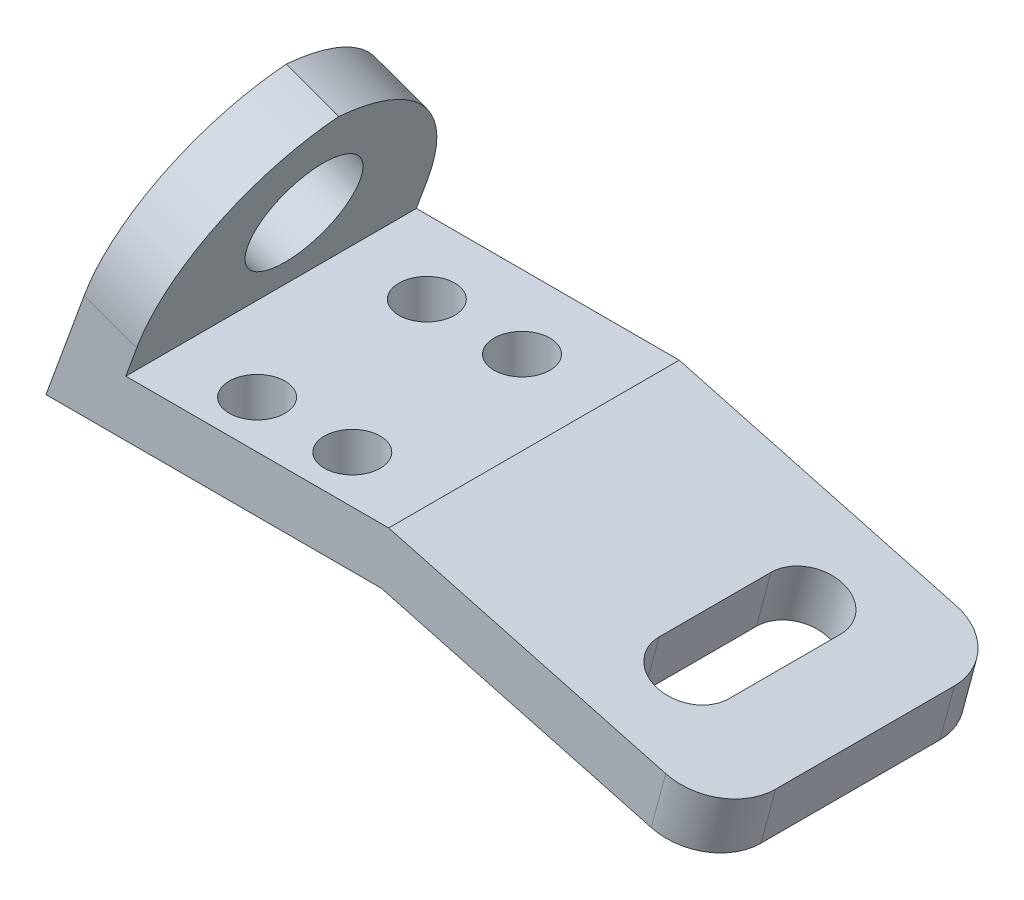
from build123d import *

# Parameters (mm, degrees)
EXTRUDE_THIN1_DEPTH = 52
SKETCH2_R           = 10
CUT_EXTRUDE2_DEPTH  = 10
FILLET1_R           = 30
CUT_EXTRUDE3_DEPTH  = 10
FILLET2_R           = 10
SKETCH4_R           = 5
CUT_EXTRUDE4_DEPTH  = 10


with BuildPart() as part:
    # Sketch1 → Extrude-Thin1 (new body)
    with BuildSketch(Plane.XY):
        Polygon((17.101007166, 46.984631039), (0, 0), (60, 0), (117.955549577, -15.529142706), (120.543740028, -5.869884443), (61.316524976, 10), (14.281480067, 10), (26.497933374, 43.564429606), align=None)
    extrude(amount=EXTRUDE_THIN1_DEPTH)

    # Sketch2 → Cut-Extrude2 (cut)
    with BuildSketch(Plane(origin=(0, 0, 0), x_dir=(0, 0, 1), z_dir=(-0.9396926207859096, 0.34202014332566566, 0))):
        with Locations(Location((25.484668599, 30, 0), (0, 0, 270))):
            Circle(SKETCH2_R)
    extrude(amount=-CUT_EXTRUDE2_DEPTH, mode=Mode.SUBTRACT)

    # Fillet1
    # the kernel refuses this fillet: 30 mm, written as the material it takes off along each edge
    with BuildSketch(Plane(origin=(96.974879933, 17.912918857, 0), x_dir=(0, 0, 1), z_dir=(-0.9396926207859095, 0.34202014332566577, 0))) as fillet1_piece_1_section:
        with BuildLine():
            CenterArc((FILLET1_R, -FILLET1_R), FILLET1_R, 90, 90)
            Line((0, -FILLET1_R), (0, 0))
            Line((0, 0), (FILLET1_R, 0))
        make_face()
    fillet1_piece_1 = extrude(amount=160, mode=Mode.PRIVATE)
    fillet1_piece_1 = split(fillet1_piece_1, bisect_by=Plane(origin=(19.547189191, 10, 6.743574493), z_dir=(0, 1, 0)), keep=Keep.TOP, mode=Mode.PRIVATE)
    add(fillet1_piece_1, mode=Mode.SUBTRACT)
    with BuildSketch(Plane(origin=(96.974879933, 17.912918857, 52), x_dir=(0, 0, -1), z_dir=(-0.9396926207859095, 0.34202014332566577, 0))) as fillet1_piece_2_section:
        with BuildLine():
            CenterArc((FILLET1_R, FILLET1_R), FILLET1_R, 180, 90)
            Line((0, FILLET1_R), (0, 0))
            Line((0, 0), (FILLET1_R, 0))
        make_face()
    fillet1_piece_2 = extrude(amount=160, mode=Mode.PRIVATE)
    fillet1_piece_2 = split(fillet1_piece_2, bisect_by=Plane(origin=(19.547189191, 10, 45.256425507), z_dir=(0, 1, 0)), keep=Keep.TOP, mode=Mode.PRIVATE)
    add(fillet1_piece_2, mode=Mode.SUBTRACT)

    # Sketch3 → Cut-Extrude3 (cut)
    with BuildSketch(Plane(origin=(6.607428337, 24.659258263, 0), x_dir=(0.9659258262890682, -0.25881904510252124, 0), z_dir=(0.25881904510252124, 0.9659258262890682, 0))):
        with BuildLine():
            Line((90.180356015, -36), (90.180356015, -16))
            ThreePointArc((90.180356015, -16), (96.639024601, -9.541331414), (103.097693188, -16))
            Line((103.097693188, -16), (103.097693188, -36))
            ThreePointArc((103.097693188, -36), (96.639024601, -42.458668586), (90.180356015, -36))
        make_face()
    extrude(amount=-CUT_EXTRUDE3_DEPTH, mode=Mode.SUBTRACT)

    # Fillet2
    fillet2_edges = [part.edges().sort_by_distance(p)[0] for p in [
        (119.249644803, -10.699513575, 52),
        (119.249644803, -10.699513575, 0),
    ]]
    fillet(fillet2_edges, radius=FILLET2_R)

    # Sketch4 → Cut-Extrude4 (cut)
    with BuildSketch(Plane(origin=(0, 10, 0), x_dir=(1, 0, 0), z_dir=(0, 1, 0))):
        with Locations(Location((29.281480067, -43.506992199, 0), (0, 0, 270))):
            Circle(SKETCH4_R)
        with Locations(Location((29.281480067, -13.135621251, 0), (0, 0, 270))):
            Circle(SKETCH4_R)
        with Locations(Location((46.316524976, -13.135621251, 0), (0, 0, 270))):
            Circle(SKETCH4_R)
        with Locations(Location((46.316524976, -43.506992199, 0), (0, 0, 270))):
            Circle(SKETCH4_R)
    extrude(amount=-CUT_EXTRUDE4_DEPTH, mode=Mode.SUBTRACT)


solid = part.part
